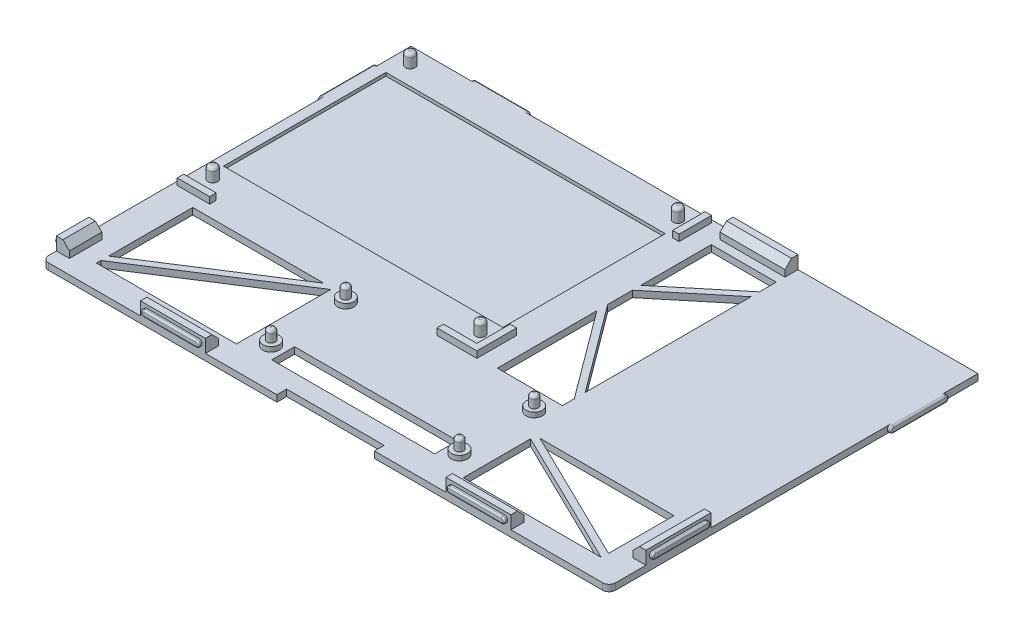
from build123d import *

# Parameters (mm, degrees)
SKETCH_1_W          = 174.55
SKETCH_1_H          = 113.55
EXTRUDE_1_DEPTH     = 2
SKETCH_3_W          = 2
SKETCH_3_H          = 10
SKETCH_3_W_2        = 10
SKETCH_3_H_2        = 2
EXTRUDE_2_DEPTH     = 2
SKETCH_4_R          = 1.45
EXTRUDE_3_DEPTH     = 4
FILLET_2_R          = 1
SKETCH_5_W          = 86
SKETCH_5_H          = 50
CUT_EXTRUDE_1_DEPTH = 1
SKETCH_8_R          = 2.5
EXTRUDE_4_DEPTH     = 1.5
SKETCH_8_3_R        = 1.25
EXTRUDE_5_DEPTH     = 5
FILLET_3_R          = 1
SKETCH_9_W          = 50.159646102
SKETCH_9_H          = 7
SKETCH_9_W_2        = 30
SKETCH_9_H_2        = 3
CUT_EXTRUDE_2_DEPTH = 2
SKETCH_10_W         = 20
SKETCH_10_H         = 4
SKETCH_10_W_2       = 4
SKETCH_10_H_2       = 20
SKETCH_10_H_3       = 10
EXTRUDE_6_DEPTH     = 4
CUT_EXTRUDE_3_DEPTH = 105.236875673
FILLET_1_R          = 2
CHAMFER_1_SIZE      = 2
EXTRUDE_8_DEPTH     = 1
EXTRUDE_9_DEPTH     = 1
EXTRUDE_11_DEPTH    = 1
EXTRUDE_12_DEPTH    = 1
BOSS_EXTRUDE1_DEPTH = 1
BOSS_EXTRUDE2_DEPTH = 1
FILLET_4_R          = 0.5


with BuildPart() as part:
    # 草圖1 → 填料-伸長1 (new body)
    with BuildSketch(Plane(origin=(0, 0, 0), x_dir=(1, 0, 0), z_dir=(0, 1, 0))):
        Rectangle(SKETCH_1_W, SKETCH_1_H)
    extrude(amount=EXTRUDE_1_DEPTH)

    # 草圖3 → 填料-伸長2 (add)
    with BuildSketch(Plane(origin=(0, 2, 0), x_dir=(1, 0, 0), z_dir=(0, 1, 0))):
        with Locations((5.09, 50.93)):
            Rectangle(SKETCH_3_W, SKETCH_3_H)
        Polygon((4.09, -14.07), (4.09, -4.07), (6.09, -4.07), (6.09, -14.07), (6.09, -15.07), (6.09, -16.32), (-6.16, -16.32), (-6.16, -14.32), (4.09, -14.32), align=None)
        with Locations((-81.16, -15.32)):
            Rectangle(SKETCH_3_W_2, SKETCH_3_H_2)
    extrude(amount=EXTRUDE_2_DEPTH)

    # 草圖4 → 填料-伸長3 (add)
    with BuildSketch(Plane(origin=(0, 2, 0), x_dir=(1, 0, 0), z_dir=(0, 1, 0))):
        with Locations((0.04, 51.63)):
            Circle(SKETCH_4_R)
        with Locations((0.04, -9.17)):
            Circle(SKETCH_4_R)
        with Locations((-82.36, -9.17)):
            Circle(SKETCH_4_R)
        with Locations((-82.36, 51.63)):
            Circle(SKETCH_4_R)
    extrude(amount=EXTRUDE_3_DEPTH)

    # 圓角2
    fillet_2_edges = [part.edges().sort_by_distance(p)[0] for p in [
        (-83.81, 6, -51.63),
        (-83.81, 6, 9.17),
        (-1.41, 6, 9.17),
        (-1.41, 6, -51.63),
    ]]
    fillet(fillet_2_edges, radius=FILLET_2_R)

    # 草圖5 → 除料-伸長1 (cut)
    with BuildSketch(Plane(origin=(0, 2, 0), x_dir=(1, 0, 0), z_dir=(0, 1, 0))):
        with Locations((-41.16, 20.93)):
            Rectangle(SKETCH_5_W, SKETCH_5_H)
    extrude(amount=-CUT_EXTRUDE_1_DEPTH, mode=Mode.SUBTRACT)

    # 草圖8 → 填料-伸長4 (add)
    with BuildSketch(Plane(origin=(0, 2, 0), x_dir=(1, 0, 0), z_dir=(0, 1, 0))):
        with Locations((29, -21.575)):
            Circle(SKETCH_8_R)
        with Locations((29, -44.575)):
            Circle(SKETCH_8_R)
        with Locations((-29, -44.575)):
            Circle(SKETCH_8_R)
        with Locations((-29, -21.575)):
            Circle(SKETCH_8_R)
    extrude(amount=EXTRUDE_4_DEPTH)

    # 草圖8<3> → 填料-伸長5 (add)
    with BuildSketch(Plane(origin=(0, 2, 0), x_dir=(1, 0, 0), z_dir=(0, 1, 0))):
        with Locations((29, -21.575)):
            Circle(SKETCH_8_3_R)
        with Locations((29, -44.575)):
            Circle(SKETCH_8_3_R)
        with Locations((-29, -44.575)):
            Circle(SKETCH_8_3_R)
        with Locations((-29, -21.575)):
            Circle(SKETCH_8_3_R)
    extrude(amount=EXTRUDE_5_DEPTH)

    # 圓角3
    fillet_3_edges = [part.edges().sort_by_distance(p)[0] for p in [
        (-30.25, 7, 44.575),
        (27.75, 7, 44.575),
        (27.75, 7, 21.575),
        (-30.25, 7, 21.575),
    ]]
    fillet(fillet_3_edges, radius=FILLET_3_R)

    # 草圖9 → 除料-伸長2 (cut)
    with BuildSketch(Plane(origin=(0, 2, 0), x_dir=(1, 0, 0), z_dir=(0, 1, 0))):
        with Locations((0, -44.775)):
            Rectangle(SKETCH_9_W, SKETCH_9_H)
        with Locations((0, -55.275)):
            Rectangle(SKETCH_9_W_2, SKETCH_9_H_2)
    extrude(amount=-CUT_EXTRUDE_2_DEPTH, mode=Mode.SUBTRACT)

    # 草圖10 → 填料-伸長6 (add)
    with BuildSketch(Plane(origin=(0, 2, 0), x_dir=(1, 0, 0), z_dir=(0, 1, 0))):
        with Locations((21.854715439, 54.775)):
            Rectangle(SKETCH_10_W, SKETCH_10_H)
        with Locations((85.275, -35.43799868)):
            Rectangle(SKETCH_10_W_2, SKETCH_10_H_2)
        with Locations((47.031889085, -54.775)):
            Rectangle(SKETCH_10_W, SKETCH_10_H)
        with Locations((-47.031889085, -54.775)):
            Rectangle(SKETCH_10_W, SKETCH_10_H)
        with Locations((-85.275, -47.4)):
            Rectangle(SKETCH_10_W_2, SKETCH_10_H_3)
    extrude(amount=EXTRUDE_6_DEPTH)

    # 草圖11 → 除料-伸長3 (cut, through all)
    with BuildSketch(Plane(origin=(0, 2, 0), x_dir=(1, 0, 0), z_dir=(0, 1, 0))):
        Polygon((-77.879578173, -45.722583606), (-37.497069547, -19.823892626), (-77.879578173, -19.823892626), align=None)
        Polygon((-77.879578173, -49.467196386), (-34.764514275, -49.467196386), (-34.764514275, -20.447382192), (-77.879578173, -48.098554803), align=None)
        Polygon((31.854715439, 44.917489498), (11.854715439, 28.410289152), (11.854715439, 50.090728689), (31.854715439, 50.090728689), align=None)
        Polygon((11.854715439, -15.752914676), (31.854715439, -15.752914676), (31.854715439, -12.091582027), (11.854715439, 14.843632999), align=None)
        Polygon((11.854715439, 25.817052443), (31.854715439, 42.324252788), (31.854715439, -8.736726131), (11.854715439, 18.198488896), align=None)
        Polygon((78.359380095, -48.062791021), (37.115806701, -27.915068386), (78.359380095, -27.915068386), align=None)
        Polygon((35.80419089, -29.5002187), (35.80419089, -50.229107424), (78.237445455, -50.229107424), align=None)
    extrude(amount=-CUT_EXTRUDE_3_DEPTH, mode=Mode.SUBTRACT)

    # 圓角1
    fillet_1_edges = [part.edges().sort_by_distance(p)[0] for p in [
        (-87.275, 1, 56.775),
        (87.275, 1, 56.775),
    ]]
    fillet(fillet_1_edges, radius=FILLET_1_R)

    # 導角1
    chamfer_1_edges = [part.edges().sort_by_distance(p)[0] for p in [
        (83.275, 6, 35.43799868),
        (47.031889085, 6, 52.775),
        (-47.031889085, 6, 52.775),
        (-83.275, 6, 47.4),
        (21.854715439, 6, -52.775),
    ]]
    chamfer(chamfer_1_edges, length=CHAMFER_1_SIZE)

    # 草圖13 → 填料-伸長8 (add)
    with BuildSketch(Plane(origin=(87.275, 0, 0), x_dir=(0, 0, -1), z_dir=(1, 0, 0))):
        with BuildLine():
            Line((-43.43799868, 5), (-27.43799868, 5))
            ThreePointArc((-27.43799868, 5), (-26.43799868, 4), (-27.43799868, 3))
            Line((-27.43799868, 3), (-43.43799868, 3))
            ThreePointArc((-43.43799868, 3), (-44.43799868, 4), (-43.43799868, 5))
        make_face()
    extrude(amount=EXTRUDE_8_DEPTH)

    # 草圖14 → 填料-伸長9 (add)
    with BuildSketch(Plane(origin=(0, 0, -56.775), x_dir=(-1, 0, 0), z_dir=(0, 0, -1))):
        with BuildLine():
            Line((-29.854715439, 5), (-13.854715439, 5))
            ThreePointArc((-13.854715439, 5), (-12.854715439, 4), (-13.854715439, 3))
            Line((-13.854715439, 3), (-29.854715439, 3))
            ThreePointArc((-29.854715439, 3), (-30.854715439, 4), (-29.854715439, 5))
        make_face()
    extrude(amount=EXTRUDE_9_DEPTH)

    # 草圖15 → 填料-伸長11 (add)
    with BuildSketch(Plane.XY.offset(56.775)):
        with BuildLine():
            Line((-55.031889085, 5), (-39.031889085, 5))
            ThreePointArc((-39.031889085, 5), (-38.031889085, 4), (-39.031889085, 3))
            Line((-39.031889085, 3), (-55.031889085, 3))
            ThreePointArc((-55.031889085, 3), (-56.031889085, 4), (-55.031889085, 5))
        make_face()
        with BuildLine():
            Line((55.031889085, 5), (39.031889085, 5))
            ThreePointArc((39.031889085, 5), (38.031889085, 4), (39.031889085, 3))
            Line((39.031889085, 3), (55.031889085, 3))
            ThreePointArc((55.031889085, 3), (56.031889085, 4), (55.031889085, 5))
        make_face()
    extrude(amount=EXTRUDE_11_DEPTH)

    # 草圖16 → 填料-伸長12 (add)
    with BuildSketch(Plane.ZY.offset(87.275)):
        with BuildLine():
            Line((43.9, 5), (50.9, 5))
            ThreePointArc((50.9, 5), (51.9, 4), (50.9, 3))
            Line((50.9, 3), (43.9, 3))
            ThreePointArc((43.9, 3), (42.9, 4), (43.9, 5))
        make_face()
    extrude(amount=EXTRUDE_12_DEPTH)

    # Sketch1 → Boss-Extrude1 (add)
    with BuildSketch(Plane(origin=(0, 0, -56.775), x_dir=(-1, 0, 0), z_dir=(0, 0, -1))):
        with BuildLine():
            Line((68.15, 0), (52.15, 0))
            ThreePointArc((52.15, 0), (51.15, 1), (52.15, 2))
            Line((52.15, 2), (68.15, 2))
            ThreePointArc((68.15, 2), (69.15, 1), (68.15, 0))
        make_face()
    extrude(amount=BOSS_EXTRUDE1_DEPTH)

    # Sketch2 → Boss-Extrude2 (add)
    with BuildSketch(Plane(origin=(87.275, 0, 0), x_dir=(0, 0, -1), z_dir=(1, 0, 0))):
        with BuildLine():
            Line((29.84, 2), (45.84, 2))
            ThreePointArc((45.84, 2), (46.84, 1), (45.84, 0))
            Line((45.84, 0), (29.84, 0))
            ThreePointArc((29.84, 0), (28.84, 1), (29.84, 2))
        make_face()
    boss_extrude2 = extrude(amount=BOSS_EXTRUDE2_DEPTH)

    # Mirror1: Boss-Extrude2 across plane
    add(boss_extrude2.mirror(Plane.ZY))

    # 圓角4
    fillet_4_edges = [part.edges().sort_by_distance(p)[0] for p in [
        (12.854715439, 4, -57.775),
        (21.854715439, 3, -57.775),
        (30.854715439, 4, -57.775),
        (88.275, 4, 26.43799868),
        (88.275, 3, 35.43799868),
        (88.275, 4, 44.43799868),
        (56.031889085, 4, 57.775),
        (47.031889085, 3, 57.775),
        (38.031889085, 4, 57.775),
        (-88.275, 4, 51.9),
        (-88.275, 3, 47.4),
        (-88.275, 4, 42.9),
        (-38.031889085, 4, 57.775),
        (-47.031889085, 3, 57.775),
        (-56.031889085, 4, 57.775),
        (21.854715439, 5, -57.775),
        (88.275, 5, 35.43799868),
        (47.031889085, 5, 57.775),
        (-88.275, 5, 47.4),
        (-47.031889085, 5, 57.775),
        (-88.275, 1, -46.84),
        (-88.275, 0, -37.84),
        (-88.275, 1, -28.84),
        (88.275, 1, -46.84),
        (88.275, 0, -37.84),
        (88.275, 1, -28.84),
        (-69.15, 1, -57.775),
        (-60.15, 0, -57.775),
        (-51.15, 1, -57.775),
        (-88.275, 2, -37.84),
        (88.275, 2, -37.84),
        (-60.15, 2, -57.775),
    ]]
    fillet(fillet_4_edges, radius=FILLET_4_R)


solid = part.part
